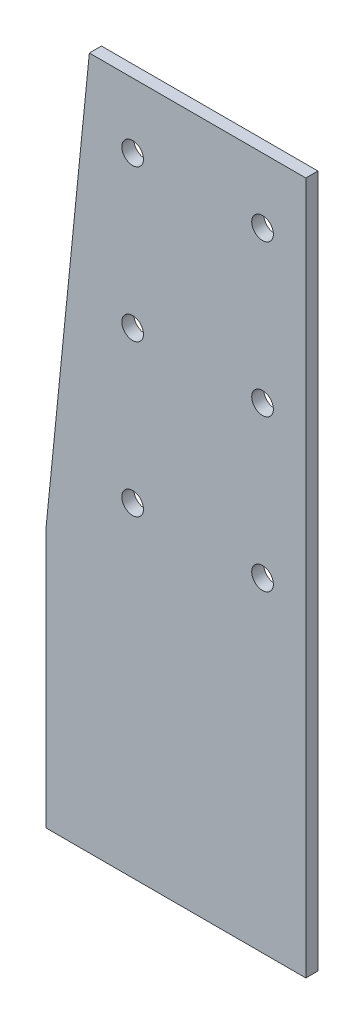
from build123d import *

# Parameters (mm, degrees)
BOSS_EXTRUDE1_DEPTH             = 3.556
F_1_4_0_25_DIAMETER_HOLE1_D     = 6.35
F_1_4_0_25_DIAMETER_HOLE1_DEPTH = 101.6
F_1_4_0_25_DIAMETER_HOLE1_TIP   = 1.907732465
F_1_4_0_25_DIAMETER_HOLE2_D     = 6.35
F_1_4_0_25_DIAMETER_HOLE2_DEPTH = 101.6
F_1_4_0_25_DIAMETER_HOLE2_TIP   = 1.907732465


with BuildPart() as part:
    # Sketch1 → Boss-Extrude1 (new body)
    with BuildSketch(Plane.XY):
        Polygon((-42.952942124, 356.788581407), (-42.952942124, 280.588581407), (33.247057876, 280.588581407), (33.247057876, 483.788581407), (-30.252942124, 483.788581407), align=None)
    extrude(amount=BOSS_EXTRUDE1_DEPTH)

    # 1/4 (0.25) Diameter Hole1
    with Locations(Plane(origin=(-249.539252178, -228.511493423, -41.656), x_dir=(-1.0, -1.0349876298566839e-08, 0), z_dir=(0, 0, -1))):
        with Locations((-270.086317003, 693.250072448), (-231.986317003, 693.250072747), (-270.086316654, 648.800072448), (-231.986316654, 648.800072747), (-270.086316305, 604.350072448), (-231.986316305, 604.350072747)):
            Hole(F_1_4_0_25_DIAMETER_HOLE1_D / 2, depth=F_1_4_0_25_DIAMETER_HOLE1_DEPTH)
            with Locations((0, 0, -(F_1_4_0_25_DIAMETER_HOLE1_DEPTH + F_1_4_0_25_DIAMETER_HOLE1_TIP / 2))):  # 118° drill point
                Cone(0, F_1_4_0_25_DIAMETER_HOLE1_D / 2, F_1_4_0_25_DIAMETER_HOLE1_TIP, mode=Mode.SUBTRACT)

    # 1/4 (0.25) Diameter Hole2
    with Locations(Plane(origin=(-249.539252178, -228.511493423, 0), x_dir=(-1.0, -1.0349876298566839e-08, 0), z_dir=(0, 0, -1))):
        with Locations((-270.086317003, 693.250072448), (-231.986317003, 693.250072747), (-270.086316654, 648.800072448), (-231.986316654, 648.800072747), (-270.086316305, 604.350072448), (-231.986316305, 604.350072747)):
            Hole(F_1_4_0_25_DIAMETER_HOLE2_D / 2, depth=F_1_4_0_25_DIAMETER_HOLE2_DEPTH)
            with Locations((0, 0, -(F_1_4_0_25_DIAMETER_HOLE2_DEPTH + F_1_4_0_25_DIAMETER_HOLE2_TIP / 2))):  # 118° drill point
                Cone(0, F_1_4_0_25_DIAMETER_HOLE2_D / 2, F_1_4_0_25_DIAMETER_HOLE2_TIP, mode=Mode.SUBTRACT)


solid = part.part
